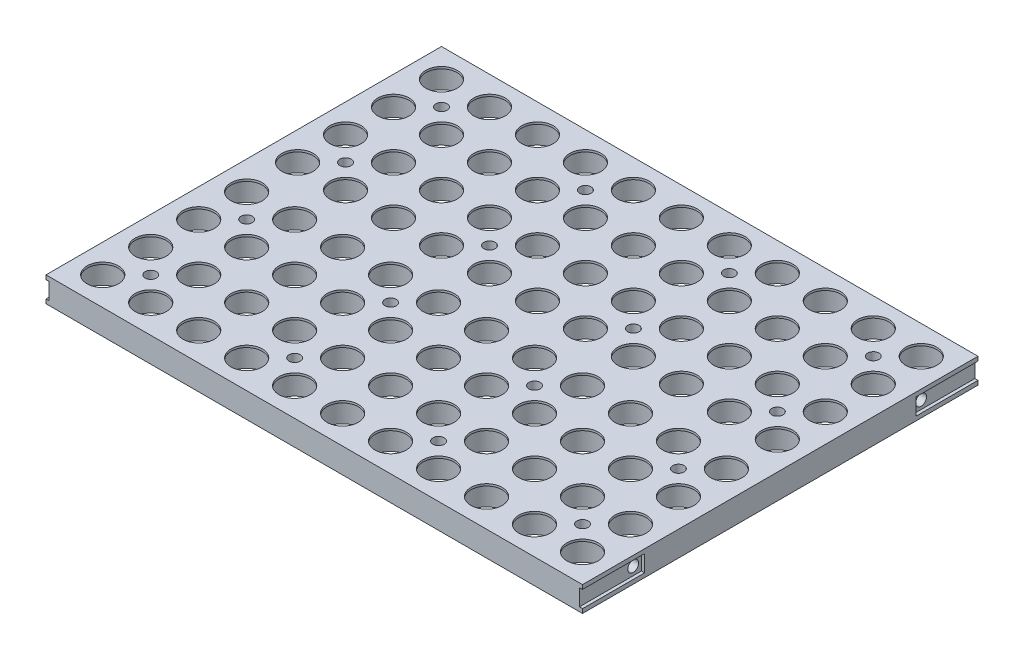
from build123d import *

# Parameters (mm, degrees)
SKETCH1_W                = 257.2
SKETCH1_H                = 189.6
BOSS_EXTRUDE1_DEPTH      = 12
CUT_EXTRUDE1_START       = -12
SKETCH2_R                = 10.8
CUT_EXTRUDE1_DEPTH       = 11
SKETCH17_R               = 7.5
CUT_EXTRUDE5_DEPTH       = 320.756157095
LPATTERN1_COUNT          = 4
LPATTERN1_PITCH          = 23
LPATTERN1_COUNT_DIR2     = 11
LPATTERN1_PITCH_DIR2     = 23
MIRROR7_START            = -12
MIRROR7_COPY_1_SKETCH_R  = 10.8
MIRROR7_COPY_1_DEPTH     = 11
MIRROR7_COPY_2_SKETCH_R  = 10.8
MIRROR7_COPY_2_DEPTH     = 11
MIRROR7_COPY_3_SKETCH_R  = 10.8
MIRROR7_COPY_3_DEPTH     = 11
MIRROR7_COPY_4_SKETCH_R  = 10.8
MIRROR7_COPY_4_DEPTH     = 11
MIRROR7_COPY_5_SKETCH_R  = 10.8
MIRROR7_COPY_5_DEPTH     = 11
MIRROR7_COPY_6_SKETCH_R  = 10.8
MIRROR7_COPY_6_DEPTH     = 11
MIRROR7_COPY_7_SKETCH_R  = 10.8
MIRROR7_COPY_7_DEPTH     = 11
MIRROR7_COPY_8_SKETCH_R  = 10.8
MIRROR7_COPY_8_DEPTH     = 11
MIRROR7_COPY_9_SKETCH_R  = 10.8
MIRROR7_COPY_9_DEPTH     = 11
MIRROR7_COPY_10_SKETCH_R = 10.8
MIRROR7_COPY_10_DEPTH    = 11
MIRROR7_COPY_11_SKETCH_R = 10.8
MIRROR7_COPY_11_DEPTH    = 11
MIRROR7_COPY_12_SKETCH_R = 10.8
MIRROR7_COPY_12_DEPTH    = 11
MIRROR7_COPY_13_SKETCH_R = 10.8
MIRROR7_COPY_13_DEPTH    = 11
MIRROR7_COPY_14_SKETCH_R = 10.8
MIRROR7_COPY_14_DEPTH    = 11
MIRROR7_COPY_15_SKETCH_R = 10.8
MIRROR7_COPY_15_DEPTH    = 11
MIRROR7_COPY_16_SKETCH_R = 10.8
MIRROR7_COPY_16_DEPTH    = 11
MIRROR7_COPY_17_SKETCH_R = 10.8
MIRROR7_COPY_17_DEPTH    = 11
MIRROR7_COPY_18_SKETCH_R = 10.8
MIRROR7_COPY_18_DEPTH    = 11
MIRROR7_COPY_19_SKETCH_R = 10.8
MIRROR7_COPY_19_DEPTH    = 11
MIRROR7_COPY_20_SKETCH_R = 10.8
MIRROR7_COPY_20_DEPTH    = 11
MIRROR7_COPY_21_SKETCH_R = 10.8
MIRROR7_COPY_21_DEPTH    = 11
MIRROR7_COPY_22_SKETCH_R = 10.8
MIRROR7_COPY_22_DEPTH    = 11
MIRROR7_COPY_23_SKETCH_R = 10.8
MIRROR7_COPY_23_DEPTH    = 11
MIRROR7_COPY_24_SKETCH_R = 10.8
MIRROR7_COPY_24_DEPTH    = 11
MIRROR7_COPY_25_SKETCH_R = 10.8
MIRROR7_COPY_25_DEPTH    = 11
MIRROR7_COPY_26_SKETCH_R = 10.8
MIRROR7_COPY_26_DEPTH    = 11
MIRROR7_COPY_27_SKETCH_R = 10.8
MIRROR7_COPY_27_DEPTH    = 11
MIRROR7_COPY_28_SKETCH_R = 10.8
MIRROR7_COPY_28_DEPTH    = 11
MIRROR7_COPY_29_SKETCH_R = 10.8
MIRROR7_COPY_29_DEPTH    = 11
MIRROR7_COPY_30_SKETCH_R = 10.8
MIRROR7_COPY_30_DEPTH    = 11
MIRROR7_COPY_31_SKETCH_R = 10.8
MIRROR7_COPY_31_DEPTH    = 11
MIRROR7_COPY_32_SKETCH_R = 10.8
MIRROR7_COPY_32_DEPTH    = 11
MIRROR7_COPY_33_SKETCH_R = 10.8
MIRROR7_COPY_33_DEPTH    = 11
MIRROR7_COPY_34_SKETCH_R = 10.8
MIRROR7_COPY_34_DEPTH    = 11
MIRROR7_COPY_35_SKETCH_R = 10.8
MIRROR7_COPY_35_DEPTH    = 11
MIRROR7_COPY_36_SKETCH_R = 10.8
MIRROR7_COPY_36_DEPTH    = 11
MIRROR7_COPY_37_SKETCH_R = 10.8
MIRROR7_COPY_37_DEPTH    = 11
MIRROR7_COPY_38_SKETCH_R = 10.8
MIRROR7_COPY_38_DEPTH    = 11
MIRROR7_COPY_39_SKETCH_R = 10.8
MIRROR7_COPY_39_DEPTH    = 11
MIRROR7_COPY_40_SKETCH_R = 10.8
MIRROR7_COPY_40_DEPTH    = 11
MIRROR7_COPY_41_SKETCH_R = 10.8
MIRROR7_COPY_41_DEPTH    = 11
MIRROR7_COPY_42_SKETCH_R = 10.8
MIRROR7_COPY_42_DEPTH    = 11
MIRROR7_COPY_43_SKETCH_R = 10.8
MIRROR7_COPY_43_DEPTH    = 11
MIRROR7_COPY_44_SKETCH_R = 7.5
MIRROR7_COPY_44_DEPTH    = 320.756157095
MIRROR7_COPY_45_SKETCH_R = 7.5
MIRROR7_COPY_45_DEPTH    = 320.756157095
MIRROR7_COPY_46_SKETCH_R = 7.5
MIRROR7_COPY_46_DEPTH    = 320.756157095
MIRROR7_COPY_47_SKETCH_R = 7.5
MIRROR7_COPY_47_DEPTH    = 320.756157095
MIRROR7_COPY_48_SKETCH_R = 7.5
MIRROR7_COPY_48_DEPTH    = 320.756157095
MIRROR7_COPY_49_SKETCH_R = 7.5
MIRROR7_COPY_49_DEPTH    = 320.756157095
MIRROR7_COPY_50_SKETCH_R = 7.5
MIRROR7_COPY_50_DEPTH    = 320.756157095
MIRROR7_COPY_51_SKETCH_R = 7.5
MIRROR7_COPY_51_DEPTH    = 320.756157095
MIRROR7_COPY_52_SKETCH_R = 7.5
MIRROR7_COPY_52_DEPTH    = 320.756157095
MIRROR7_COPY_53_SKETCH_R = 7.5
MIRROR7_COPY_53_DEPTH    = 320.756157095
MIRROR7_COPY_54_SKETCH_R = 7.5
MIRROR7_COPY_54_DEPTH    = 320.756157095
MIRROR7_COPY_55_SKETCH_R = 7.5
MIRROR7_COPY_55_DEPTH    = 320.756157095
MIRROR7_COPY_56_SKETCH_R = 7.5
MIRROR7_COPY_56_DEPTH    = 320.756157095
MIRROR7_COPY_57_SKETCH_R = 7.5
MIRROR7_COPY_57_DEPTH    = 320.756157095
MIRROR7_COPY_58_SKETCH_R = 7.5
MIRROR7_COPY_58_DEPTH    = 320.756157095
MIRROR7_COPY_59_SKETCH_R = 7.5
MIRROR7_COPY_59_DEPTH    = 320.756157095
MIRROR7_COPY_60_SKETCH_R = 7.5
MIRROR7_COPY_60_DEPTH    = 320.756157095
MIRROR7_COPY_61_SKETCH_R = 7.5
MIRROR7_COPY_61_DEPTH    = 320.756157095
MIRROR7_COPY_62_SKETCH_R = 7.5
MIRROR7_COPY_62_DEPTH    = 320.756157095
MIRROR7_COPY_63_SKETCH_R = 7.5
MIRROR7_COPY_63_DEPTH    = 320.756157095
MIRROR7_COPY_64_SKETCH_R = 7.5
MIRROR7_COPY_64_DEPTH    = 320.756157095
MIRROR7_COPY_65_SKETCH_R = 7.5
MIRROR7_COPY_65_DEPTH    = 320.756157095
MIRROR7_COPY_66_SKETCH_R = 7.5
MIRROR7_COPY_66_DEPTH    = 320.756157095
MIRROR7_COPY_67_SKETCH_R = 7.5
MIRROR7_COPY_67_DEPTH    = 320.756157095
MIRROR7_COPY_68_SKETCH_R = 7.5
MIRROR7_COPY_68_DEPTH    = 320.756157095
MIRROR7_COPY_69_SKETCH_R = 7.5
MIRROR7_COPY_69_DEPTH    = 320.756157095
MIRROR7_COPY_70_SKETCH_R = 7.5
MIRROR7_COPY_70_DEPTH    = 320.756157095
MIRROR7_COPY_71_SKETCH_R = 7.5
MIRROR7_COPY_71_DEPTH    = 320.756157095
MIRROR7_COPY_72_SKETCH_R = 7.5
MIRROR7_COPY_72_DEPTH    = 320.756157095
MIRROR7_COPY_73_SKETCH_R = 7.5
MIRROR7_COPY_73_DEPTH    = 320.756157095
MIRROR7_COPY_74_SKETCH_R = 7.5
MIRROR7_COPY_74_DEPTH    = 320.756157095
MIRROR7_COPY_75_SKETCH_R = 7.5
MIRROR7_COPY_75_DEPTH    = 320.756157095
MIRROR7_COPY_76_SKETCH_R = 7.5
MIRROR7_COPY_76_DEPTH    = 320.756157095
MIRROR7_COPY_77_SKETCH_R = 7.5
MIRROR7_COPY_77_DEPTH    = 320.756157095
MIRROR7_COPY_78_SKETCH_R = 7.5
MIRROR7_COPY_78_DEPTH    = 320.756157095
MIRROR7_COPY_79_SKETCH_R = 7.5
MIRROR7_COPY_79_DEPTH    = 320.756157095
MIRROR7_COPY_80_SKETCH_R = 7.5
MIRROR7_COPY_80_DEPTH    = 320.756157095
MIRROR7_COPY_81_SKETCH_R = 7.5
MIRROR7_COPY_81_DEPTH    = 320.756157095
MIRROR7_COPY_82_SKETCH_R = 7.5
MIRROR7_COPY_82_DEPTH    = 320.756157095
MIRROR7_COPY_83_SKETCH_R = 7.5
MIRROR7_COPY_83_DEPTH    = 320.756157095
MIRROR7_COPY_84_SKETCH_R = 7.5
MIRROR7_COPY_84_DEPTH    = 320.756157095
MIRROR7_COPY_85_SKETCH_R = 7.5
MIRROR7_COPY_85_DEPTH    = 320.756157095
MIRROR7_COPY_86_SKETCH_R = 7.5
MIRROR7_COPY_86_DEPTH    = 320.756157095
ADVANCEDHOLE1_OUTLINE_R  = 2.7
ADVANCEDHOLE1_DEPTH      = 12
LPATTERN5_COUNT          = 2
LPATTERN5_PITCH          = 46
MIRROR1_COPY_1_SKETCH_R  = 2.7
MIRROR1_COPY_1_DEPTH     = 12
SKETCH9_W                = 29.8
SKETCH9_H                = 8
CUT_EXTRUDE4_DEPTH       = 1.5
MIRROR6_COPY_1_SKETCH_W  = 29.8
MIRROR6_COPY_1_SKETCH_H  = 8
MIRROR6_COPY_1_DEPTH     = 1.5


# Read off the part's stored shape, not the designer's step: AdvancedHole1, AdvancedHole3
with BuildPart() as part:
    # Sketch1 → Boss-Extrude1 (new body)
    with BuildSketch(Plane(origin=(0, 0, 0), x_dir=(1, 0, 0), z_dir=(0, 1, 0))):
        with Locations((128.6, 94.8)):
            Rectangle(SKETCH1_W, SKETCH1_H)
    extrude(amount=BOSS_EXTRUDE1_DEPTH)

    # Sketch2 → Cut-Extrude1 (cut)
    with BuildSketch(Plane(origin=(0, 12, 0), x_dir=(1, 0, 0), z_dir=(0, 1, 0)).offset(CUT_EXTRUDE1_START)):
        with Locations(Location((13.6, 13.6, 0), (0, 0, 90))):
            Circle(SKETCH2_R)
    cut_extrude1 = extrude(amount=CUT_EXTRUDE1_DEPTH, mode=Mode.SUBTRACT)

    # Sketch17 → Cut-Extrude5 (cut, through all)
    with BuildSketch(Plane(origin=(0, 12, 0), x_dir=(1, 0, 0), z_dir=(0, 1, 0))):
        with Locations(Location((13.6, 13.6, 0), (0, 0, 270))):
            Circle(SKETCH17_R)
    cut_extrude5 = extrude(amount=-CUT_EXTRUDE5_DEPTH, mode=Mode.SUBTRACT)

    # LPattern1: Cut-Extrude1, Cut-Extrude5 4 × 11
    with Locations(*[(j * LPATTERN1_PITCH_DIR2, 0, -i * LPATTERN1_PITCH) for i in range(LPATTERN1_COUNT) for j in range(LPATTERN1_COUNT_DIR2) if (i, j) != (0, 0)]):
        add(cut_extrude1, mode=Mode.SUBTRACT)
        add(cut_extrude5, mode=Mode.SUBTRACT)

    # Mirror7: Cut-Extrude1, Cut-Extrude5 across plane
    add(cut_extrude1.mirror(Plane.XY.offset(-94.8)), mode=Mode.SUBTRACT)
    add(cut_extrude5.mirror(Plane.XY.offset(-94.8)), mode=Mode.SUBTRACT)

    # Mirror7 copy 1 sketch → Mirror7 copy 1 (cut)
    with BuildSketch(Plane(origin=(23, 12, -189.6), x_dir=(1, 0, 0), z_dir=(0, 1, 0)).offset(MIRROR7_START)):
        with Locations((13.6, -13.6)):
            Circle(MIRROR7_COPY_1_SKETCH_R)
    extrude(amount=MIRROR7_COPY_1_DEPTH, mode=Mode.SUBTRACT)

    # Mirror7 copy 2 sketch → Mirror7 copy 2 (cut)
    with BuildSketch(Plane(origin=(46, 12, -189.6), x_dir=(1, 0, 0), z_dir=(0, 1, 0)).offset(MIRROR7_START)):
        with Locations((13.6, -13.6)):
            Circle(MIRROR7_COPY_2_SKETCH_R)
    extrude(amount=MIRROR7_COPY_2_DEPTH, mode=Mode.SUBTRACT)

    # Mirror7 copy 3 sketch → Mirror7 copy 3 (cut)
    with BuildSketch(Plane(origin=(69, 12, -189.6), x_dir=(1, 0, 0), z_dir=(0, 1, 0)).offset(MIRROR7_START)):
        with Locations((13.6, -13.6)):
            Circle(MIRROR7_COPY_3_SKETCH_R)
    extrude(amount=MIRROR7_COPY_3_DEPTH, mode=Mode.SUBTRACT)

    # Mirror7 copy 4 sketch → Mirror7 copy 4 (cut)
    with BuildSketch(Plane(origin=(92, 12, -189.6), x_dir=(1, 0, 0), z_dir=(0, 1, 0)).offset(MIRROR7_START)):
        with Locations((13.6, -13.6)):
            Circle(MIRROR7_COPY_4_SKETCH_R)
    extrude(amount=MIRROR7_COPY_4_DEPTH, mode=Mode.SUBTRACT)

    # Mirror7 copy 5 sketch → Mirror7 copy 5 (cut)
    with BuildSketch(Plane(origin=(115, 12, -189.6), x_dir=(1, 0, 0), z_dir=(0, 1, 0)).offset(MIRROR7_START)):
        with Locations((13.6, -13.6)):
            Circle(MIRROR7_COPY_5_SKETCH_R)
    extrude(amount=MIRROR7_COPY_5_DEPTH, mode=Mode.SUBTRACT)

    # Mirror7 copy 6 sketch → Mirror7 copy 6 (cut)
    with BuildSketch(Plane(origin=(138, 12, -189.6), x_dir=(1, 0, 0), z_dir=(0, 1, 0)).offset(MIRROR7_START)):
        with Locations((13.6, -13.6)):
            Circle(MIRROR7_COPY_6_SKETCH_R)
    extrude(amount=MIRROR7_COPY_6_DEPTH, mode=Mode.SUBTRACT)

    # Mirror7 copy 7 sketch → Mirror7 copy 7 (cut)
    with BuildSketch(Plane(origin=(161, 12, -189.6), x_dir=(1, 0, 0), z_dir=(0, 1, 0)).offset(MIRROR7_START)):
        with Locations((13.6, -13.6)):
            Circle(MIRROR7_COPY_7_SKETCH_R)
    extrude(amount=MIRROR7_COPY_7_DEPTH, mode=Mode.SUBTRACT)

    # Mirror7 copy 8 sketch → Mirror7 copy 8 (cut)
    with BuildSketch(Plane(origin=(184, 12, -189.6), x_dir=(1, 0, 0), z_dir=(0, 1, 0)).offset(MIRROR7_START)):
        with Locations((13.6, -13.6)):
            Circle(MIRROR7_COPY_8_SKETCH_R)
    extrude(amount=MIRROR7_COPY_8_DEPTH, mode=Mode.SUBTRACT)

    # Mirror7 copy 9 sketch → Mirror7 copy 9 (cut)
    with BuildSketch(Plane(origin=(207, 12, -189.6), x_dir=(1, 0, 0), z_dir=(0, 1, 0)).offset(MIRROR7_START)):
        with Locations((13.6, -13.6)):
            Circle(MIRROR7_COPY_9_SKETCH_R)
    extrude(amount=MIRROR7_COPY_9_DEPTH, mode=Mode.SUBTRACT)

    # Mirror7 copy 10 sketch → Mirror7 copy 10 (cut)
    with BuildSketch(Plane(origin=(230, 12, -189.6), x_dir=(1, 0, 0), z_dir=(0, 1, 0)).offset(MIRROR7_START)):
        with Locations((13.6, -13.6)):
            Circle(MIRROR7_COPY_10_SKETCH_R)
    extrude(amount=MIRROR7_COPY_10_DEPTH, mode=Mode.SUBTRACT)

    # Mirror7 copy 11 sketch → Mirror7 copy 11 (cut)
    with BuildSketch(Plane(origin=(0, 12, -166.6), x_dir=(1, 0, 0), z_dir=(0, 1, 0)).offset(MIRROR7_START)):
        with Locations((13.6, -13.6)):
            Circle(MIRROR7_COPY_11_SKETCH_R)
    extrude(amount=MIRROR7_COPY_11_DEPTH, mode=Mode.SUBTRACT)

    # Mirror7 copy 12 sketch → Mirror7 copy 12 (cut)
    with BuildSketch(Plane(origin=(23, 12, -166.6), x_dir=(1, 0, 0), z_dir=(0, 1, 0)).offset(MIRROR7_START)):
        with Locations((13.6, -13.6)):
            Circle(MIRROR7_COPY_12_SKETCH_R)
    extrude(amount=MIRROR7_COPY_12_DEPTH, mode=Mode.SUBTRACT)

    # Mirror7 copy 13 sketch → Mirror7 copy 13 (cut)
    with BuildSketch(Plane(origin=(46, 12, -166.6), x_dir=(1, 0, 0), z_dir=(0, 1, 0)).offset(MIRROR7_START)):
        with Locations((13.6, -13.6)):
            Circle(MIRROR7_COPY_13_SKETCH_R)
    extrude(amount=MIRROR7_COPY_13_DEPTH, mode=Mode.SUBTRACT)

    # Mirror7 copy 14 sketch → Mirror7 copy 14 (cut)
    with BuildSketch(Plane(origin=(69, 12, -166.6), x_dir=(1, 0, 0), z_dir=(0, 1, 0)).offset(MIRROR7_START)):
        with Locations((13.6, -13.6)):
            Circle(MIRROR7_COPY_14_SKETCH_R)
    extrude(amount=MIRROR7_COPY_14_DEPTH, mode=Mode.SUBTRACT)

    # Mirror7 copy 15 sketch → Mirror7 copy 15 (cut)
    with BuildSketch(Plane(origin=(92, 12, -166.6), x_dir=(1, 0, 0), z_dir=(0, 1, 0)).offset(MIRROR7_START)):
        with Locations((13.6, -13.6)):
            Circle(MIRROR7_COPY_15_SKETCH_R)
    extrude(amount=MIRROR7_COPY_15_DEPTH, mode=Mode.SUBTRACT)

    # Mirror7 copy 16 sketch → Mirror7 copy 16 (cut)
    with BuildSketch(Plane(origin=(115, 12, -166.6), x_dir=(1, 0, 0), z_dir=(0, 1, 0)).offset(MIRROR7_START)):
        with Locations((13.6, -13.6)):
            Circle(MIRROR7_COPY_16_SKETCH_R)
    extrude(amount=MIRROR7_COPY_16_DEPTH, mode=Mode.SUBTRACT)

    # Mirror7 copy 17 sketch → Mirror7 copy 17 (cut)
    with BuildSketch(Plane(origin=(138, 12, -166.6), x_dir=(1, 0, 0), z_dir=(0, 1, 0)).offset(MIRROR7_START)):
        with Locations((13.6, -13.6)):
            Circle(MIRROR7_COPY_17_SKETCH_R)
    extrude(amount=MIRROR7_COPY_17_DEPTH, mode=Mode.SUBTRACT)

    # Mirror7 copy 18 sketch → Mirror7 copy 18 (cut)
    with BuildSketch(Plane(origin=(161, 12, -166.6), x_dir=(1, 0, 0), z_dir=(0, 1, 0)).offset(MIRROR7_START)):
        with Locations((13.6, -13.6)):
            Circle(MIRROR7_COPY_18_SKETCH_R)
    extrude(amount=MIRROR7_COPY_18_DEPTH, mode=Mode.SUBTRACT)

    # Mirror7 copy 19 sketch → Mirror7 copy 19 (cut)
    with BuildSketch(Plane(origin=(184, 12, -166.6), x_dir=(1, 0, 0), z_dir=(0, 1, 0)).offset(MIRROR7_START)):
        with Locations((13.6, -13.6)):
            Circle(MIRROR7_COPY_19_SKETCH_R)
    extrude(amount=MIRROR7_COPY_19_DEPTH, mode=Mode.SUBTRACT)

    # Mirror7 copy 20 sketch → Mirror7 copy 20 (cut)
    with BuildSketch(Plane(origin=(207, 12, -166.6), x_dir=(1, 0, 0), z_dir=(0, 1, 0)).offset(MIRROR7_START)):
        with Locations((13.6, -13.6)):
            Circle(MIRROR7_COPY_20_SKETCH_R)
    extrude(amount=MIRROR7_COPY_20_DEPTH, mode=Mode.SUBTRACT)

    # Mirror7 copy 21 sketch → Mirror7 copy 21 (cut)
    with BuildSketch(Plane(origin=(230, 12, -166.6), x_dir=(1, 0, 0), z_dir=(0, 1, 0)).offset(MIRROR7_START)):
        with Locations((13.6, -13.6)):
            Circle(MIRROR7_COPY_21_SKETCH_R)
    extrude(amount=MIRROR7_COPY_21_DEPTH, mode=Mode.SUBTRACT)

    # Mirror7 copy 22 sketch → Mirror7 copy 22 (cut)
    with BuildSketch(Plane(origin=(0, 12, -143.6), x_dir=(1, 0, 0), z_dir=(0, 1, 0)).offset(MIRROR7_START)):
        with Locations((13.6, -13.6)):
            Circle(MIRROR7_COPY_22_SKETCH_R)
    extrude(amount=MIRROR7_COPY_22_DEPTH, mode=Mode.SUBTRACT)

    # Mirror7 copy 23 sketch → Mirror7 copy 23 (cut)
    with BuildSketch(Plane(origin=(23, 12, -143.6), x_dir=(1, 0, 0), z_dir=(0, 1, 0)).offset(MIRROR7_START)):
        with Locations((13.6, -13.6)):
            Circle(MIRROR7_COPY_23_SKETCH_R)
    extrude(amount=MIRROR7_COPY_23_DEPTH, mode=Mode.SUBTRACT)

    # Mirror7 copy 24 sketch → Mirror7 copy 24 (cut)
    with BuildSketch(Plane(origin=(46, 12, -143.6), x_dir=(1, 0, 0), z_dir=(0, 1, 0)).offset(MIRROR7_START)):
        with Locations((13.6, -13.6)):
            Circle(MIRROR7_COPY_24_SKETCH_R)
    extrude(amount=MIRROR7_COPY_24_DEPTH, mode=Mode.SUBTRACT)

    # Mirror7 copy 25 sketch → Mirror7 copy 25 (cut)
    with BuildSketch(Plane(origin=(69, 12, -143.6), x_dir=(1, 0, 0), z_dir=(0, 1, 0)).offset(MIRROR7_START)):
        with Locations((13.6, -13.6)):
            Circle(MIRROR7_COPY_25_SKETCH_R)
    extrude(amount=MIRROR7_COPY_25_DEPTH, mode=Mode.SUBTRACT)

    # Mirror7 copy 26 sketch → Mirror7 copy 26 (cut)
    with BuildSketch(Plane(origin=(92, 12, -143.6), x_dir=(1, 0, 0), z_dir=(0, 1, 0)).offset(MIRROR7_START)):
        with Locations((13.6, -13.6)):
            Circle(MIRROR7_COPY_26_SKETCH_R)
    extrude(amount=MIRROR7_COPY_26_DEPTH, mode=Mode.SUBTRACT)

    # Mirror7 copy 27 sketch → Mirror7 copy 27 (cut)
    with BuildSketch(Plane(origin=(115, 12, -143.6), x_dir=(1, 0, 0), z_dir=(0, 1, 0)).offset(MIRROR7_START)):
        with Locations((13.6, -13.6)):
            Circle(MIRROR7_COPY_27_SKETCH_R)
    extrude(amount=MIRROR7_COPY_27_DEPTH, mode=Mode.SUBTRACT)

    # Mirror7 copy 28 sketch → Mirror7 copy 28 (cut)
    with BuildSketch(Plane(origin=(138, 12, -143.6), x_dir=(1, 0, 0), z_dir=(0, 1, 0)).offset(MIRROR7_START)):
        with Locations((13.6, -13.6)):
            Circle(MIRROR7_COPY_28_SKETCH_R)
    extrude(amount=MIRROR7_COPY_28_DEPTH, mode=Mode.SUBTRACT)

    # Mirror7 copy 29 sketch → Mirror7 copy 29 (cut)
    with BuildSketch(Plane(origin=(161, 12, -143.6), x_dir=(1, 0, 0), z_dir=(0, 1, 0)).offset(MIRROR7_START)):
        with Locations((13.6, -13.6)):
            Circle(MIRROR7_COPY_29_SKETCH_R)
    extrude(amount=MIRROR7_COPY_29_DEPTH, mode=Mode.SUBTRACT)

    # Mirror7 copy 30 sketch → Mirror7 copy 30 (cut)
    with BuildSketch(Plane(origin=(184, 12, -143.6), x_dir=(1, 0, 0), z_dir=(0, 1, 0)).offset(MIRROR7_START)):
        with Locations((13.6, -13.6)):
            Circle(MIRROR7_COPY_30_SKETCH_R)
    extrude(amount=MIRROR7_COPY_30_DEPTH, mode=Mode.SUBTRACT)

    # Mirror7 copy 31 sketch → Mirror7 copy 31 (cut)
    with BuildSketch(Plane(origin=(207, 12, -143.6), x_dir=(1, 0, 0), z_dir=(0, 1, 0)).offset(MIRROR7_START)):
        with Locations((13.6, -13.6)):
            Circle(MIRROR7_COPY_31_SKETCH_R)
    extrude(amount=MIRROR7_COPY_31_DEPTH, mode=Mode.SUBTRACT)

    # Mirror7 copy 32 sketch → Mirror7 copy 32 (cut)
    with BuildSketch(Plane(origin=(230, 12, -143.6), x_dir=(1, 0, 0), z_dir=(0, 1, 0)).offset(MIRROR7_START)):
        with Locations((13.6, -13.6)):
            Circle(MIRROR7_COPY_32_SKETCH_R)
    extrude(amount=MIRROR7_COPY_32_DEPTH, mode=Mode.SUBTRACT)

    # Mirror7 copy 33 sketch → Mirror7 copy 33 (cut)
    with BuildSketch(Plane(origin=(0, 12, -120.6), x_dir=(1, 0, 0), z_dir=(0, 1, 0)).offset(MIRROR7_START)):
        with Locations((13.6, -13.6)):
            Circle(MIRROR7_COPY_33_SKETCH_R)
    extrude(amount=MIRROR7_COPY_33_DEPTH, mode=Mode.SUBTRACT)

    # Mirror7 copy 34 sketch → Mirror7 copy 34 (cut)
    with BuildSketch(Plane(origin=(23, 12, -120.6), x_dir=(1, 0, 0), z_dir=(0, 1, 0)).offset(MIRROR7_START)):
        with Locations((13.6, -13.6)):
            Circle(MIRROR7_COPY_34_SKETCH_R)
    extrude(amount=MIRROR7_COPY_34_DEPTH, mode=Mode.SUBTRACT)

    # Mirror7 copy 35 sketch → Mirror7 copy 35 (cut)
    with BuildSketch(Plane(origin=(46, 12, -120.6), x_dir=(1, 0, 0), z_dir=(0, 1, 0)).offset(MIRROR7_START)):
        with Locations((13.6, -13.6)):
            Circle(MIRROR7_COPY_35_SKETCH_R)
    extrude(amount=MIRROR7_COPY_35_DEPTH, mode=Mode.SUBTRACT)

    # Mirror7 copy 36 sketch → Mirror7 copy 36 (cut)
    with BuildSketch(Plane(origin=(69, 12, -120.6), x_dir=(1, 0, 0), z_dir=(0, 1, 0)).offset(MIRROR7_START)):
        with Locations((13.6, -13.6)):
            Circle(MIRROR7_COPY_36_SKETCH_R)
    extrude(amount=MIRROR7_COPY_36_DEPTH, mode=Mode.SUBTRACT)

    # Mirror7 copy 37 sketch → Mirror7 copy 37 (cut)
    with BuildSketch(Plane(origin=(92, 12, -120.6), x_dir=(1, 0, 0), z_dir=(0, 1, 0)).offset(MIRROR7_START)):
        with Locations((13.6, -13.6)):
            Circle(MIRROR7_COPY_37_SKETCH_R)
    extrude(amount=MIRROR7_COPY_37_DEPTH, mode=Mode.SUBTRACT)

    # Mirror7 copy 38 sketch → Mirror7 copy 38 (cut)
    with BuildSketch(Plane(origin=(115, 12, -120.6), x_dir=(1, 0, 0), z_dir=(0, 1, 0)).offset(MIRROR7_START)):
        with Locations((13.6, -13.6)):
            Circle(MIRROR7_COPY_38_SKETCH_R)
    extrude(amount=MIRROR7_COPY_38_DEPTH, mode=Mode.SUBTRACT)

    # Mirror7 copy 39 sketch → Mirror7 copy 39 (cut)
    with BuildSketch(Plane(origin=(138, 12, -120.6), x_dir=(1, 0, 0), z_dir=(0, 1, 0)).offset(MIRROR7_START)):
        with Locations((13.6, -13.6)):
            Circle(MIRROR7_COPY_39_SKETCH_R)
    extrude(amount=MIRROR7_COPY_39_DEPTH, mode=Mode.SUBTRACT)

    # Mirror7 copy 40 sketch → Mirror7 copy 40 (cut)
    with BuildSketch(Plane(origin=(161, 12, -120.6), x_dir=(1, 0, 0), z_dir=(0, 1, 0)).offset(MIRROR7_START)):
        with Locations((13.6, -13.6)):
            Circle(MIRROR7_COPY_40_SKETCH_R)
    extrude(amount=MIRROR7_COPY_40_DEPTH, mode=Mode.SUBTRACT)

    # Mirror7 copy 41 sketch → Mirror7 copy 41 (cut)
    with BuildSketch(Plane(origin=(184, 12, -120.6), x_dir=(1, 0, 0), z_dir=(0, 1, 0)).offset(MIRROR7_START)):
        with Locations((13.6, -13.6)):
            Circle(MIRROR7_COPY_41_SKETCH_R)
    extrude(amount=MIRROR7_COPY_41_DEPTH, mode=Mode.SUBTRACT)

    # Mirror7 copy 42 sketch → Mirror7 copy 42 (cut)
    with BuildSketch(Plane(origin=(207, 12, -120.6), x_dir=(1, 0, 0), z_dir=(0, 1, 0)).offset(MIRROR7_START)):
        with Locations((13.6, -13.6)):
            Circle(MIRROR7_COPY_42_SKETCH_R)
    extrude(amount=MIRROR7_COPY_42_DEPTH, mode=Mode.SUBTRACT)

    # Mirror7 copy 43 sketch → Mirror7 copy 43 (cut)
    with BuildSketch(Plane(origin=(230, 12, -120.6), x_dir=(1, 0, 0), z_dir=(0, 1, 0)).offset(MIRROR7_START)):
        with Locations((13.6, -13.6)):
            Circle(MIRROR7_COPY_43_SKETCH_R)
    extrude(amount=MIRROR7_COPY_43_DEPTH, mode=Mode.SUBTRACT)

    # Mirror7 copy 44 sketch → Mirror7 copy 44 (cut, through all)
    with BuildSketch(Plane(origin=(23, 12, -189.6), x_dir=(1, 0, 0), z_dir=(0, 1, 0))):
        with Locations((13.6, -13.6)):
            Circle(MIRROR7_COPY_44_SKETCH_R)
    extrude(amount=-MIRROR7_COPY_44_DEPTH, mode=Mode.SUBTRACT)

    # Mirror7 copy 45 sketch → Mirror7 copy 45 (cut, through all)
    with BuildSketch(Plane(origin=(46, 12, -189.6), x_dir=(1, 0, 0), z_dir=(0, 1, 0))):
        with Locations((13.6, -13.6)):
            Circle(MIRROR7_COPY_45_SKETCH_R)
    extrude(amount=-MIRROR7_COPY_45_DEPTH, mode=Mode.SUBTRACT)

    # Mirror7 copy 46 sketch → Mirror7 copy 46 (cut, through all)
    with BuildSketch(Plane(origin=(69, 12, -189.6), x_dir=(1, 0, 0), z_dir=(0, 1, 0))):
        with Locations((13.6, -13.6)):
            Circle(MIRROR7_COPY_46_SKETCH_R)
    extrude(amount=-MIRROR7_COPY_46_DEPTH, mode=Mode.SUBTRACT)

    # Mirror7 copy 47 sketch → Mirror7 copy 47 (cut, through all)
    with BuildSketch(Plane(origin=(92, 12, -189.6), x_dir=(1, 0, 0), z_dir=(0, 1, 0))):
        with Locations((13.6, -13.6)):
            Circle(MIRROR7_COPY_47_SKETCH_R)
    extrude(amount=-MIRROR7_COPY_47_DEPTH, mode=Mode.SUBTRACT)

    # Mirror7 copy 48 sketch → Mirror7 copy 48 (cut, through all)
    with BuildSketch(Plane(origin=(115, 12, -189.6), x_dir=(1, 0, 0), z_dir=(0, 1, 0))):
        with Locations((13.6, -13.6)):
            Circle(MIRROR7_COPY_48_SKETCH_R)
    extrude(amount=-MIRROR7_COPY_48_DEPTH, mode=Mode.SUBTRACT)

    # Mirror7 copy 49 sketch → Mirror7 copy 49 (cut, through all)
    with BuildSketch(Plane(origin=(138, 12, -189.6), x_dir=(1, 0, 0), z_dir=(0, 1, 0))):
        with Locations((13.6, -13.6)):
            Circle(MIRROR7_COPY_49_SKETCH_R)
    extrude(amount=-MIRROR7_COPY_49_DEPTH, mode=Mode.SUBTRACT)

    # Mirror7 copy 50 sketch → Mirror7 copy 50 (cut, through all)
    with BuildSketch(Plane(origin=(161, 12, -189.6), x_dir=(1, 0, 0), z_dir=(0, 1, 0))):
        with Locations((13.6, -13.6)):
            Circle(MIRROR7_COPY_50_SKETCH_R)
    extrude(amount=-MIRROR7_COPY_50_DEPTH, mode=Mode.SUBTRACT)

    # Mirror7 copy 51 sketch → Mirror7 copy 51 (cut, through all)
    with BuildSketch(Plane(origin=(184, 12, -189.6), x_dir=(1, 0, 0), z_dir=(0, 1, 0))):
        with Locations((13.6, -13.6)):
            Circle(MIRROR7_COPY_51_SKETCH_R)
    extrude(amount=-MIRROR7_COPY_51_DEPTH, mode=Mode.SUBTRACT)

    # Mirror7 copy 52 sketch → Mirror7 copy 52 (cut, through all)
    with BuildSketch(Plane(origin=(207, 12, -189.6), x_dir=(1, 0, 0), z_dir=(0, 1, 0))):
        with Locations((13.6, -13.6)):
            Circle(MIRROR7_COPY_52_SKETCH_R)
    extrude(amount=-MIRROR7_COPY_52_DEPTH, mode=Mode.SUBTRACT)

    # Mirror7 copy 53 sketch → Mirror7 copy 53 (cut, through all)
    with BuildSketch(Plane(origin=(230, 12, -189.6), x_dir=(1, 0, 0), z_dir=(0, 1, 0))):
        with Locations((13.6, -13.6)):
            Circle(MIRROR7_COPY_53_SKETCH_R)
    extrude(amount=-MIRROR7_COPY_53_DEPTH, mode=Mode.SUBTRACT)

    # Mirror7 copy 54 sketch → Mirror7 copy 54 (cut, through all)
    with BuildSketch(Plane(origin=(0, 12, -166.6), x_dir=(1, 0, 0), z_dir=(0, 1, 0))):
        with Locations((13.6, -13.6)):
            Circle(MIRROR7_COPY_54_SKETCH_R)
    extrude(amount=-MIRROR7_COPY_54_DEPTH, mode=Mode.SUBTRACT)

    # Mirror7 copy 55 sketch → Mirror7 copy 55 (cut, through all)
    with BuildSketch(Plane(origin=(23, 12, -166.6), x_dir=(1, 0, 0), z_dir=(0, 1, 0))):
        with Locations((13.6, -13.6)):
            Circle(MIRROR7_COPY_55_SKETCH_R)
    extrude(amount=-MIRROR7_COPY_55_DEPTH, mode=Mode.SUBTRACT)

    # Mirror7 copy 56 sketch → Mirror7 copy 56 (cut, through all)
    with BuildSketch(Plane(origin=(46, 12, -166.6), x_dir=(1, 0, 0), z_dir=(0, 1, 0))):
        with Locations((13.6, -13.6)):
            Circle(MIRROR7_COPY_56_SKETCH_R)
    extrude(amount=-MIRROR7_COPY_56_DEPTH, mode=Mode.SUBTRACT)

    # Mirror7 copy 57 sketch → Mirror7 copy 57 (cut, through all)
    with BuildSketch(Plane(origin=(69, 12, -166.6), x_dir=(1, 0, 0), z_dir=(0, 1, 0))):
        with Locations((13.6, -13.6)):
            Circle(MIRROR7_COPY_57_SKETCH_R)
    extrude(amount=-MIRROR7_COPY_57_DEPTH, mode=Mode.SUBTRACT)

    # Mirror7 copy 58 sketch → Mirror7 copy 58 (cut, through all)
    with BuildSketch(Plane(origin=(92, 12, -166.6), x_dir=(1, 0, 0), z_dir=(0, 1, 0))):
        with Locations((13.6, -13.6)):
            Circle(MIRROR7_COPY_58_SKETCH_R)
    extrude(amount=-MIRROR7_COPY_58_DEPTH, mode=Mode.SUBTRACT)

    # Mirror7 copy 59 sketch → Mirror7 copy 59 (cut, through all)
    with BuildSketch(Plane(origin=(115, 12, -166.6), x_dir=(1, 0, 0), z_dir=(0, 1, 0))):
        with Locations((13.6, -13.6)):
            Circle(MIRROR7_COPY_59_SKETCH_R)
    extrude(amount=-MIRROR7_COPY_59_DEPTH, mode=Mode.SUBTRACT)

    # Mirror7 copy 60 sketch → Mirror7 copy 60 (cut, through all)
    with BuildSketch(Plane(origin=(138, 12, -166.6), x_dir=(1, 0, 0), z_dir=(0, 1, 0))):
        with Locations((13.6, -13.6)):
            Circle(MIRROR7_COPY_60_SKETCH_R)
    extrude(amount=-MIRROR7_COPY_60_DEPTH, mode=Mode.SUBTRACT)

    # Mirror7 copy 61 sketch → Mirror7 copy 61 (cut, through all)
    with BuildSketch(Plane(origin=(161, 12, -166.6), x_dir=(1, 0, 0), z_dir=(0, 1, 0))):
        with Locations((13.6, -13.6)):
            Circle(MIRROR7_COPY_61_SKETCH_R)
    extrude(amount=-MIRROR7_COPY_61_DEPTH, mode=Mode.SUBTRACT)

    # Mirror7 copy 62 sketch → Mirror7 copy 62 (cut, through all)
    with BuildSketch(Plane(origin=(184, 12, -166.6), x_dir=(1, 0, 0), z_dir=(0, 1, 0))):
        with Locations((13.6, -13.6)):
            Circle(MIRROR7_COPY_62_SKETCH_R)
    extrude(amount=-MIRROR7_COPY_62_DEPTH, mode=Mode.SUBTRACT)

    # Mirror7 copy 63 sketch → Mirror7 copy 63 (cut, through all)
    with BuildSketch(Plane(origin=(207, 12, -166.6), x_dir=(1, 0, 0), z_dir=(0, 1, 0))):
        with Locations((13.6, -13.6)):
            Circle(MIRROR7_COPY_63_SKETCH_R)
    extrude(amount=-MIRROR7_COPY_63_DEPTH, mode=Mode.SUBTRACT)

    # Mirror7 copy 64 sketch → Mirror7 copy 64 (cut, through all)
    with BuildSketch(Plane(origin=(230, 12, -166.6), x_dir=(1, 0, 0), z_dir=(0, 1, 0))):
        with Locations((13.6, -13.6)):
            Circle(MIRROR7_COPY_64_SKETCH_R)
    extrude(amount=-MIRROR7_COPY_64_DEPTH, mode=Mode.SUBTRACT)

    # Mirror7 copy 65 sketch → Mirror7 copy 65 (cut, through all)
    with BuildSketch(Plane(origin=(0, 12, -143.6), x_dir=(1, 0, 0), z_dir=(0, 1, 0))):
        with Locations((13.6, -13.6)):
            Circle(MIRROR7_COPY_65_SKETCH_R)
    extrude(amount=-MIRROR7_COPY_65_DEPTH, mode=Mode.SUBTRACT)

    # Mirror7 copy 66 sketch → Mirror7 copy 66 (cut, through all)
    with BuildSketch(Plane(origin=(23, 12, -143.6), x_dir=(1, 0, 0), z_dir=(0, 1, 0))):
        with Locations((13.6, -13.6)):
            Circle(MIRROR7_COPY_66_SKETCH_R)
    extrude(amount=-MIRROR7_COPY_66_DEPTH, mode=Mode.SUBTRACT)

    # Mirror7 copy 67 sketch → Mirror7 copy 67 (cut, through all)
    with BuildSketch(Plane(origin=(46, 12, -143.6), x_dir=(1, 0, 0), z_dir=(0, 1, 0))):
        with Locations((13.6, -13.6)):
            Circle(MIRROR7_COPY_67_SKETCH_R)
    extrude(amount=-MIRROR7_COPY_67_DEPTH, mode=Mode.SUBTRACT)

    # Mirror7 copy 68 sketch → Mirror7 copy 68 (cut, through all)
    with BuildSketch(Plane(origin=(69, 12, -143.6), x_dir=(1, 0, 0), z_dir=(0, 1, 0))):
        with Locations((13.6, -13.6)):
            Circle(MIRROR7_COPY_68_SKETCH_R)
    extrude(amount=-MIRROR7_COPY_68_DEPTH, mode=Mode.SUBTRACT)

    # Mirror7 copy 69 sketch → Mirror7 copy 69 (cut, through all)
    with BuildSketch(Plane(origin=(92, 12, -143.6), x_dir=(1, 0, 0), z_dir=(0, 1, 0))):
        with Locations((13.6, -13.6)):
            Circle(MIRROR7_COPY_69_SKETCH_R)
    extrude(amount=-MIRROR7_COPY_69_DEPTH, mode=Mode.SUBTRACT)

    # Mirror7 copy 70 sketch → Mirror7 copy 70 (cut, through all)
    with BuildSketch(Plane(origin=(115, 12, -143.6), x_dir=(1, 0, 0), z_dir=(0, 1, 0))):
        with Locations((13.6, -13.6)):
            Circle(MIRROR7_COPY_70_SKETCH_R)
    extrude(amount=-MIRROR7_COPY_70_DEPTH, mode=Mode.SUBTRACT)

    # Mirror7 copy 71 sketch → Mirror7 copy 71 (cut, through all)
    with BuildSketch(Plane(origin=(138, 12, -143.6), x_dir=(1, 0, 0), z_dir=(0, 1, 0))):
        with Locations((13.6, -13.6)):
            Circle(MIRROR7_COPY_71_SKETCH_R)
    extrude(amount=-MIRROR7_COPY_71_DEPTH, mode=Mode.SUBTRACT)

    # Mirror7 copy 72 sketch → Mirror7 copy 72 (cut, through all)
    with BuildSketch(Plane(origin=(161, 12, -143.6), x_dir=(1, 0, 0), z_dir=(0, 1, 0))):
        with Locations((13.6, -13.6)):
            Circle(MIRROR7_COPY_72_SKETCH_R)
    extrude(amount=-MIRROR7_COPY_72_DEPTH, mode=Mode.SUBTRACT)

    # Mirror7 copy 73 sketch → Mirror7 copy 73 (cut, through all)
    with BuildSketch(Plane(origin=(184, 12, -143.6), x_dir=(1, 0, 0), z_dir=(0, 1, 0))):
        with Locations((13.6, -13.6)):
            Circle(MIRROR7_COPY_73_SKETCH_R)
    extrude(amount=-MIRROR7_COPY_73_DEPTH, mode=Mode.SUBTRACT)

    # Mirror7 copy 74 sketch → Mirror7 copy 74 (cut, through all)
    with BuildSketch(Plane(origin=(207, 12, -143.6), x_dir=(1, 0, 0), z_dir=(0, 1, 0))):
        with Locations((13.6, -13.6)):
            Circle(MIRROR7_COPY_74_SKETCH_R)
    extrude(amount=-MIRROR7_COPY_74_DEPTH, mode=Mode.SUBTRACT)

    # Mirror7 copy 75 sketch → Mirror7 copy 75 (cut, through all)
    with BuildSketch(Plane(origin=(230, 12, -143.6), x_dir=(1, 0, 0), z_dir=(0, 1, 0))):
        with Locations((13.6, -13.6)):
            Circle(MIRROR7_COPY_75_SKETCH_R)
    extrude(amount=-MIRROR7_COPY_75_DEPTH, mode=Mode.SUBTRACT)

    # Mirror7 copy 76 sketch → Mirror7 copy 76 (cut, through all)
    with BuildSketch(Plane(origin=(0, 12, -120.6), x_dir=(1, 0, 0), z_dir=(0, 1, 0))):
        with Locations((13.6, -13.6)):
            Circle(MIRROR7_COPY_76_SKETCH_R)
    extrude(amount=-MIRROR7_COPY_76_DEPTH, mode=Mode.SUBTRACT)

    # Mirror7 copy 77 sketch → Mirror7 copy 77 (cut, through all)
    with BuildSketch(Plane(origin=(23, 12, -120.6), x_dir=(1, 0, 0), z_dir=(0, 1, 0))):
        with Locations((13.6, -13.6)):
            Circle(MIRROR7_COPY_77_SKETCH_R)
    extrude(amount=-MIRROR7_COPY_77_DEPTH, mode=Mode.SUBTRACT)

    # Mirror7 copy 78 sketch → Mirror7 copy 78 (cut, through all)
    with BuildSketch(Plane(origin=(46, 12, -120.6), x_dir=(1, 0, 0), z_dir=(0, 1, 0))):
        with Locations((13.6, -13.6)):
            Circle(MIRROR7_COPY_78_SKETCH_R)
    extrude(amount=-MIRROR7_COPY_78_DEPTH, mode=Mode.SUBTRACT)

    # Mirror7 copy 79 sketch → Mirror7 copy 79 (cut, through all)
    with BuildSketch(Plane(origin=(69, 12, -120.6), x_dir=(1, 0, 0), z_dir=(0, 1, 0))):
        with Locations((13.6, -13.6)):
            Circle(MIRROR7_COPY_79_SKETCH_R)
    extrude(amount=-MIRROR7_COPY_79_DEPTH, mode=Mode.SUBTRACT)

    # Mirror7 copy 80 sketch → Mirror7 copy 80 (cut, through all)
    with BuildSketch(Plane(origin=(92, 12, -120.6), x_dir=(1, 0, 0), z_dir=(0, 1, 0))):
        with Locations((13.6, -13.6)):
            Circle(MIRROR7_COPY_80_SKETCH_R)
    extrude(amount=-MIRROR7_COPY_80_DEPTH, mode=Mode.SUBTRACT)

    # Mirror7 copy 81 sketch → Mirror7 copy 81 (cut, through all)
    with BuildSketch(Plane(origin=(115, 12, -120.6), x_dir=(1, 0, 0), z_dir=(0, 1, 0))):
        with Locations((13.6, -13.6)):
            Circle(MIRROR7_COPY_81_SKETCH_R)
    extrude(amount=-MIRROR7_COPY_81_DEPTH, mode=Mode.SUBTRACT)

    # Mirror7 copy 82 sketch → Mirror7 copy 82 (cut, through all)
    with BuildSketch(Plane(origin=(138, 12, -120.6), x_dir=(1, 0, 0), z_dir=(0, 1, 0))):
        with Locations((13.6, -13.6)):
            Circle(MIRROR7_COPY_82_SKETCH_R)
    extrude(amount=-MIRROR7_COPY_82_DEPTH, mode=Mode.SUBTRACT)

    # Mirror7 copy 83 sketch → Mirror7 copy 83 (cut, through all)
    with BuildSketch(Plane(origin=(161, 12, -120.6), x_dir=(1, 0, 0), z_dir=(0, 1, 0))):
        with Locations((13.6, -13.6)):
            Circle(MIRROR7_COPY_83_SKETCH_R)
    extrude(amount=-MIRROR7_COPY_83_DEPTH, mode=Mode.SUBTRACT)

    # Mirror7 copy 84 sketch → Mirror7 copy 84 (cut, through all)
    with BuildSketch(Plane(origin=(184, 12, -120.6), x_dir=(1, 0, 0), z_dir=(0, 1, 0))):
        with Locations((13.6, -13.6)):
            Circle(MIRROR7_COPY_84_SKETCH_R)
    extrude(amount=-MIRROR7_COPY_84_DEPTH, mode=Mode.SUBTRACT)

    # Mirror7 copy 85 sketch → Mirror7 copy 85 (cut, through all)
    with BuildSketch(Plane(origin=(207, 12, -120.6), x_dir=(1, 0, 0), z_dir=(0, 1, 0))):
        with Locations((13.6, -13.6)):
            Circle(MIRROR7_COPY_85_SKETCH_R)
    extrude(amount=-MIRROR7_COPY_85_DEPTH, mode=Mode.SUBTRACT)

    # Mirror7 copy 86 sketch → Mirror7 copy 86 (cut, through all)
    with BuildSketch(Plane(origin=(230, 12, -120.6), x_dir=(1, 0, 0), z_dir=(0, 1, 0))):
        with Locations((13.6, -13.6)):
            Circle(MIRROR7_COPY_86_SKETCH_R)
    extrude(amount=-MIRROR7_COPY_86_DEPTH, mode=Mode.SUBTRACT)

    # AdvancedHole1 outline → AdvancedHole1 (cut)
    with BuildSketch(Plane(origin=(0, 0, 0), x_dir=(1, 0, 0), z_dir=(0, 1, 0))):
        with Locations((163.1, 118.5)):
            Circle(ADVANCEDHOLE1_OUTLINE_R)
        with Locations((94.1, 118.5)):
            Circle(ADVANCEDHOLE1_OUTLINE_R)
        with Locations((25.1, 118.5)):
            Circle(ADVANCEDHOLE1_OUTLINE_R)
        with Locations((232.1, 118.5)):
            Circle(ADVANCEDHOLE1_OUTLINE_R)
    advancedhole1 = extrude(amount=ADVANCEDHOLE1_DEPTH, mode=Mode.SUBTRACT)

    # LPattern5: AdvancedHole1 ×2
    with Locations(*[(0, 0, -i * LPATTERN5_PITCH) for i in range(1, LPATTERN5_COUNT)]):
        add(advancedhole1, mode=Mode.SUBTRACT)

    # Mirror1: AdvancedHole1 across plane
    add(advancedhole1.mirror(Plane.XY.offset(-94.8)), mode=Mode.SUBTRACT)

    # Mirror1 copy 1 sketch → Mirror1 copy 1 (cut)
    with BuildSketch(Plane(origin=(0, 0, -143.6), x_dir=(1, 0, 0), z_dir=(0, 1, 0))):
        with Locations((163.1, -118.5)):
            Circle(MIRROR1_COPY_1_SKETCH_R)
        with Locations((94.1, -118.5)):
            Circle(MIRROR1_COPY_1_SKETCH_R)
        with Locations((25.1, -118.5)):
            Circle(MIRROR1_COPY_1_SKETCH_R)
        with Locations((232.1, -118.5)):
            Circle(MIRROR1_COPY_1_SKETCH_R)
    extrude(amount=MIRROR1_COPY_1_DEPTH, mode=Mode.SUBTRACT)

    # Sketch9 → Cut-Extrude4 (cut)
    with BuildSketch(Plane.ZY):
        with Locations((-174.7, 6)):
            Rectangle(SKETCH9_W, SKETCH9_H)
    cut_extrude4 = extrude(amount=-CUT_EXTRUDE4_DEPTH, mode=Mode.SUBTRACT)

    # AdvancedHole3 outline → AdvancedHole3 (revolve, cut)
    with BuildSketch(Plane(origin=(0, 6, -163.8), x_dir=(0, 1, 0), z_dir=(0, 0, -1))):
        Polygon((2.615, 1.5), (2.524951623, 5.39), (0, 5.39), (0, 1.5), align=None)
    advancedhole3 = revolve(axis=Axis((0, 6, -163.8), (1, 0, 0)), mode=Mode.SUBTRACT)

    # Mirror5: Cut-Extrude4, AdvancedHole3 across plane
    add(cut_extrude4.mirror(Plane.XY.offset(-94.8)), mode=Mode.SUBTRACT)
    add(advancedhole3.mirror(Plane.XY.offset(-94.8)), mode=Mode.SUBTRACT)

    # Mirror6: Cut-Extrude4, AdvancedHole3 across plane
    add(cut_extrude4.mirror(Plane(origin=(128.6, 0, 0), x_dir=(0, 0, 1), z_dir=(1, 0, 0))), mode=Mode.SUBTRACT)
    add(advancedhole3.mirror(Plane(origin=(128.6, 0, 0), x_dir=(0, 0, 1), z_dir=(1, 0, 0))), mode=Mode.SUBTRACT)

    # Mirror6 copy 1 sketch → Mirror6 copy 1 (cut)
    with BuildSketch(Plane(origin=(257.2, 0, -189.6), x_dir=(0, 0, -1), z_dir=(1, 0, 0))):
        with Locations((-174.7, 6)):
            Rectangle(MIRROR6_COPY_1_SKETCH_W, MIRROR6_COPY_1_SKETCH_H)
    extrude(amount=-MIRROR6_COPY_1_DEPTH, mode=Mode.SUBTRACT)

    # Mirror6 copy 2 sketch → Mirror6 copy 2 (revolve, cut)
    with BuildSketch(Plane(origin=(257.2, 6, -25.8), x_dir=(0, 1, 0), z_dir=(0, 0, 1))):
        Polygon((2.615, 1.5), (2.524951623, 5.39), (0, 5.39), (0, 1.5), align=None)
    revolve(axis=Axis((257.2, 6, -25.8), (-1, 0, 0)), mode=Mode.SUBTRACT)


solid = part.part
